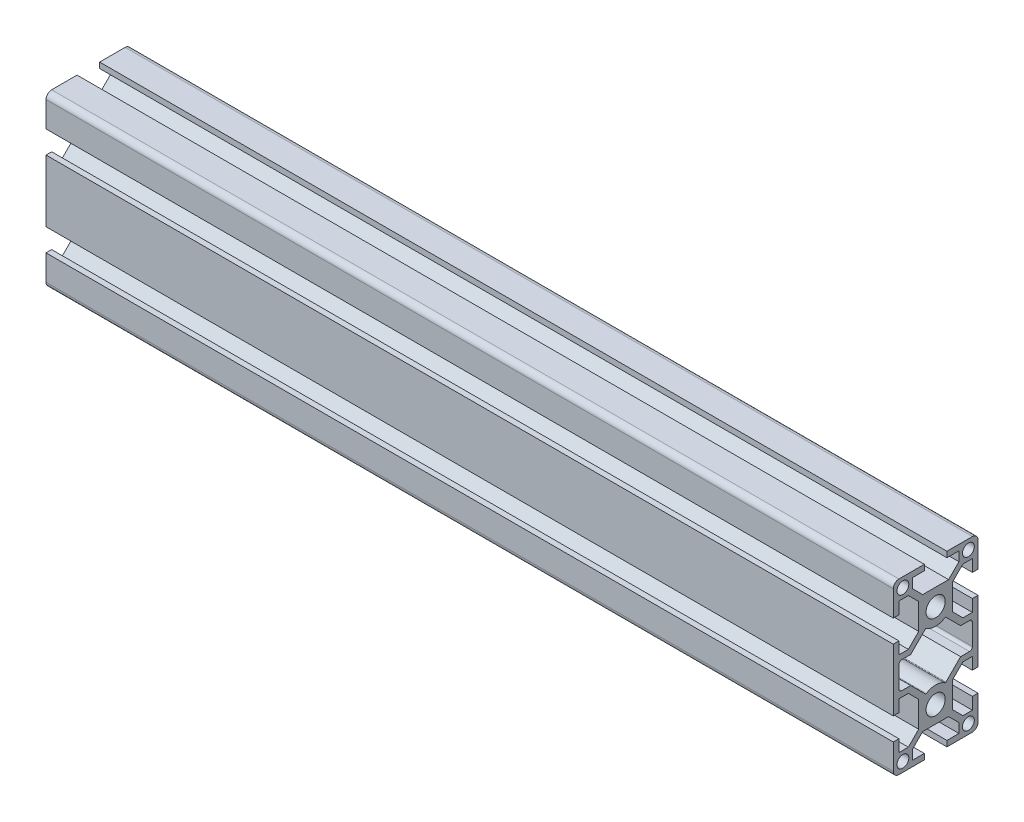
from build123d import *

# Parameters (mm, degrees)
SKETCH1_R           = 2.1
SKETCH1_R_2         = 3.4
BOSS_EXTRUDE1_DEPTH = 300


with BuildPart() as part:
    # Sketch1 → Boss-Extrude1 (new body)
    with BuildSketch(Plane(origin=(0, 0, 0), x_dir=(0, 0, -1), z_dir=(1, 0, 0))):
        with BuildLine():
            Line((-15, 28), (-15, 19))
            Line((-15, 19), (-13, 19))
            Line((-13, 19), (-13, 23.25))
            Line((-13, 23.25), (-9.664213562, 23.25))
            Line((-9.664213562, 23.25), (-6, 19.585786438))
            Line((-6, 19.585786438), (-6, 10.414213562))
            Line((-6, 10.414213562), (-9.664213562, 6.75))
            Line((-9.664213562, 6.75), (-13, 6.75))
            Line((-13, 6.75), (-13, 11))
            Line((-13, 11), (-15, 11))
            Line((-15, 11), (-15, -11))
            Line((-15, -11), (-13, -11))
            Line((-13, -11), (-13, -6.75))
            Line((-13, -6.75), (-9.664213562, -6.75))
            Line((-9.664213562, -6.75), (-6, -10.414213562))
            Line((-6, -10.414213562), (-6, -19.585786438))
            Line((-6, -19.585786438), (-9.664213562, -23.25))
            Line((-9.664213562, -23.25), (-13, -23.25))
            Line((-13, -23.25), (-13, -19))
            Line((-13, -19), (-15, -19))
            Line((-15, -19), (-15, -28))
            ThreePointArc((-15, -28), (-14.414213562, -29.414213562), (-13, -30))
            Line((-13, -30), (-4, -30))
            Line((-4, -30), (-4, -28))
            Line((-4, -28), (-8.25, -28))
            Line((-8.25, -28), (-8.25, -24.664213562))
            Line((-8.25, -24.664213562), (-4.585786438, -21))
            Line((-4.585786438, -21), (4.585786438, -21))
            Line((4.585786438, -21), (8.25, -24.664213562))
            Line((8.25, -24.664213562), (8.25, -28))
            Line((8.25, -28), (4, -28))
            Line((4, -28), (4, -30))
            Line((4, -30), (13, -30))
            ThreePointArc((13, -30), (14.414213562, -29.414213562), (15, -28))
            Line((15, -28), (15, -19))
            Line((15, -19), (13, -19))
            Line((13, -19), (13, -23.25))
            Line((13, -23.25), (9.664213562, -23.25))
            Line((9.664213562, -23.25), (6, -19.585786438))
            Line((6, -19.585786438), (6, -10.414213562))
            Line((6, -10.414213562), (9.664213562, -6.75))
            Line((9.664213562, -6.75), (13, -6.75))
            Line((13, -6.75), (13, -11))
            Line((13, -11), (15, -11))
            Line((15, -11), (15, 11))
            Line((15, 11), (13, 11))
            Line((13, 11), (13, 6.75))
            Line((13, 6.75), (9.664213562, 6.75))
            Line((9.664213562, 6.75), (6, 10.414213562))
            Line((6, 10.414213562), (6, 19.585786438))
            Line((6, 19.585786438), (9.664213562, 23.25))
            Line((9.664213562, 23.25), (13, 23.25))
            Line((13, 23.25), (13, 19))
            Line((13, 19), (15, 19))
            Line((15, 19), (15, 28))
            ThreePointArc((15, 28), (14.414213562, 29.414213562), (13, 30))
            Line((13, 30), (4, 30))
            Line((4, 30), (4, 28))
            Line((4, 28), (8.25, 28))
            Line((8.25, 28), (8.25, 24.664213562))
            Line((8.25, 24.664213562), (4.585786438, 21))
            Line((4.585786438, 21), (-4.585786438, 21))
            Line((-4.585786438, 21), (-8.25, 24.664213562))
            Line((-8.25, 24.664213562), (-8.25, 28))
            Line((-8.25, 28), (-4, 28))
            Line((-4, 28), (-4, 30))
            Line((-4, 30), (-13, 30))
            ThreePointArc((-13, 30), (-14.414213562, 29.414213562), (-15, 28))
        make_face()
        with Locations((-11.6, 26.625)):
            Circle(SKETCH1_R, mode=Mode.SUBTRACT)
        with Locations((0, 15)):
            Circle(SKETCH1_R_2, mode=Mode.SUBTRACT)
        with Locations((11.6, 26.625)):
            Circle(SKETCH1_R, mode=Mode.SUBTRACT)
        with Locations((0, -15)):
            Circle(SKETCH1_R_2, mode=Mode.SUBTRACT)
        with Locations((-11.6, -26.625)):
            Circle(SKETCH1_R, mode=Mode.SUBTRACT)
        with Locations((11.6, -26.625)):
            Circle(SKETCH1_R, mode=Mode.SUBTRACT)
        with BuildLine():
            Line((-8.835786438, 4.75), (-12, 4.75))
            ThreePointArc((-12, 4.75), (-12.707106781, 4.457106781), (-13, 3.75))
            Line((-13, 3.75), (-13, -3.75))
            ThreePointArc((-13, -3.75), (-12.707106781, -4.457106781), (-12, -4.75))
            Line((-12, -4.75), (-8.835786438, -4.75))
            Line((-8.835786438, -4.75), (-3.651792162, -9.933994275))
            ThreePointArc((-3.651792162, -9.933994275), (-3.470780401, -10.020243756), (-3.275866789, -9.973202134))
            ThreePointArc((-3.275866789, -9.973202134), (0, -9), (3.275866789, -9.973202134))
            ThreePointArc((3.275866789, -9.973202134), (3.470780401, -10.020243756), (3.651792162, -9.933994275))
            Line((3.651792162, -9.933994275), (8.835786438, -4.75))
            Line((8.835786438, -4.75), (12, -4.75))
            ThreePointArc((12, -4.75), (12.707106781, -4.457106781), (13, -3.75))
            Line((13, -3.75), (13, 3.75))
            ThreePointArc((13, 3.75), (12.707106781, 4.457106781), (12, 4.75))
            Line((12, 4.75), (8.835786438, 4.75))
            Line((8.835786438, 4.75), (3.651792162, 9.933994275))
            ThreePointArc((3.651792162, 9.933994275), (3.470780401, 10.020243756), (3.275866789, 9.973202134))
            ThreePointArc((3.275866789, 9.973202134), (0, 9), (-3.275866789, 9.973202134))
            ThreePointArc((-3.275866789, 9.973202134), (-3.470780401, 10.020243756), (-3.651792162, 9.933994275))
            Line((-3.651792162, 9.933994275), (-8.835786438, 4.75))
        make_face(mode=Mode.SUBTRACT)
    extrude(amount=BOSS_EXTRUDE1_DEPTH)


solid = part.part
